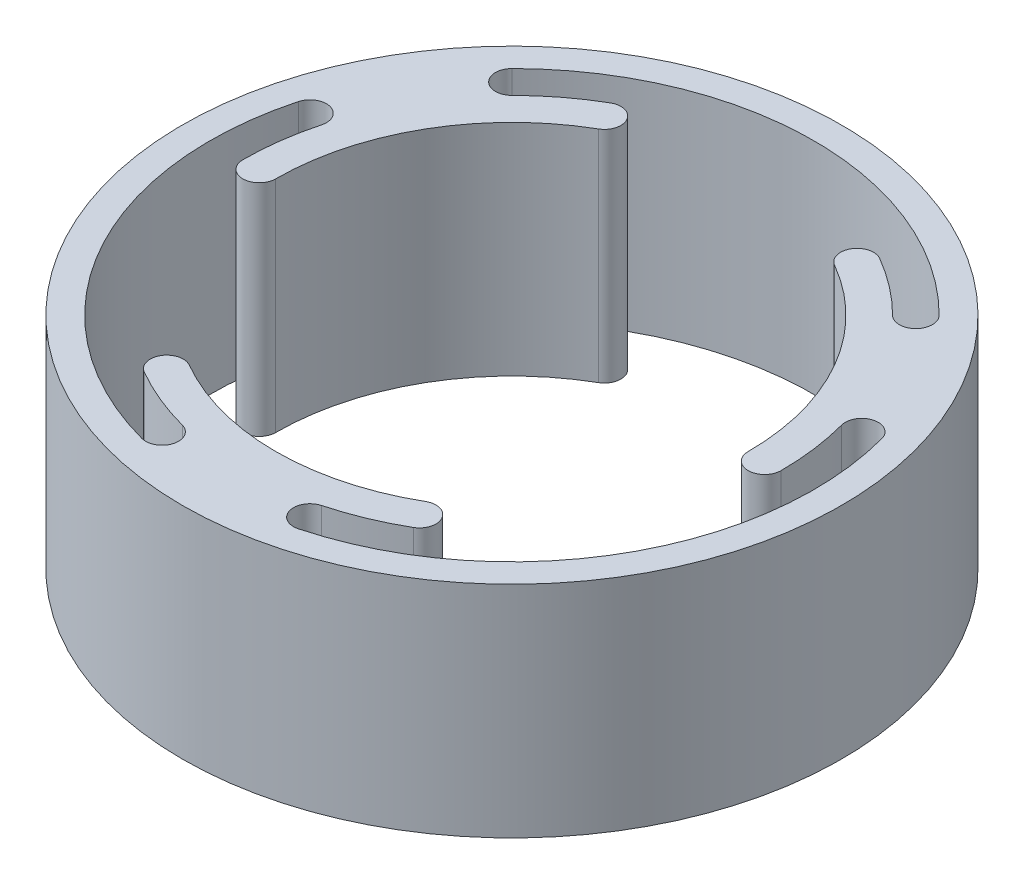
from build123d import *

# Parameters (mm, degrees)
ESQUISSE1_R          = 30
ESQUISSE1_R_2        = 19
BOSS_EXTRU_1_DEPTH   = 20
EMPREINTE1_OUTLINE_R = 19
EMPREINTE1_DEPTH     = 20


# Read off the part's stored shape, not the designer's step: Empreinte1
with BuildPart() as part:
    # Esquisse1 → Boss.-Extru.1 (new body)
    with BuildSketch(Plane(origin=(0, 0, 0), x_dir=(1, 0, 0), z_dir=(0, 1, 0))):
        with Locations(Location((0, 0, 0), (0, 0, 270))):
            Circle(ESQUISSE1_R)
        with Locations(Location((0, 0, 0), (0, 0, 270))):
            Circle(ESQUISSE1_R_2, mode=Mode.SUBTRACT)
    extrude(amount=BOSS_EXTRU_1_DEPTH)

    # Empreinte1 outline → Empreinte1 (cut)
    with BuildSketch(Plane(origin=(0, 0, 0), x_dir=(1, 0, 0), z_dir=(0, 1, 0))):
        with BuildLine():
            ThreePointArc((-12.25, 21.217622393), (-10.200961894, 20.668584287), (-10.75, 18.619546181))
            ThreePointArc((-10.75, 18.619546181), (-18.619546181, 10.75), (-21.5, 0))
            ThreePointArc((-21.5, 0), (-23, -1.5), (-24.5, 0))
            ThreePointArc((-24.5, 0), (-24.290399104, 3.197891709), (-23.665182744, 6.341066605))
            ThreePointArc((-23.665182744, 6.341066605), (-24.725842916, 8.178183912), (-26.562960223, 7.11752374))
            ThreePointArc((-26.562960223, 7.11752374), (-23.815698604, -13.75), (-7.11752374, -26.562960223))
            ThreePointArc((-7.11752374, -26.562960223), (-5.280406433, -25.502300051), (-6.341066605, -23.665182744))
            ThreePointArc((-6.341066605, -23.665182744), (-9.375744093, -22.635048547), (-12.25, -21.217622393))
            ThreePointArc((-12.25, -21.217622393), (-12.799038106, -19.168584287), (-10.75, -18.619546181))
            ThreePointArc((-10.75, -18.619546181), (0, -21.5), (10.75, -18.619546181))
            ThreePointArc((10.75, -18.619546181), (12.799038106, -19.168584287), (12.25, -21.217622393))
            ThreePointArc((12.25, -21.217622393), (9.375744093, -22.635048547), (6.341066605, -23.665182744))
            ThreePointArc((6.341066605, -23.665182744), (5.280406433, -25.502300051), (7.11752374, -26.562960223))
            ThreePointArc((7.11752374, -26.562960223), (23.815698604, -13.75), (26.562960223, 7.11752374))
            ThreePointArc((26.562960223, 7.11752374), (24.725842916, 8.178183912), (23.665182744, 6.341066605))
            ThreePointArc((23.665182744, 6.341066605), (24.290399104, 3.197891709), (24.5, 0))
            ThreePointArc((24.5, 0), (23, -1.5), (21.5, 0))
            ThreePointArc((21.5, 0), (18.619546181, 10.75), (10.75, 18.619546181))
            ThreePointArc((10.75, 18.619546181), (10.200961894, 20.668584287), (12.25, 21.217622393))
            ThreePointArc((12.25, 21.217622393), (14.914655011, 19.437156837), (17.324116139, 17.324116139))
            ThreePointArc((17.324116139, 17.324116139), (19.445436483, 17.324116139), (19.445436483, 19.445436483))
            ThreePointArc((19.445436483, 19.445436483), (0, 27.5), (-19.445436483, 19.445436483))
            ThreePointArc((-19.445436483, 19.445436483), (-19.445436483, 17.324116139), (-17.324116139, 17.324116139))
            ThreePointArc((-17.324116139, 17.324116139), (-14.914655011, 19.437156837), (-12.25, 21.217622393))
        make_face()
        Circle(EMPREINTE1_OUTLINE_R, mode=Mode.SUBTRACT)
    extrude(amount=EMPREINTE1_DEPTH, mode=Mode.SUBTRACT)


solid = part.part
